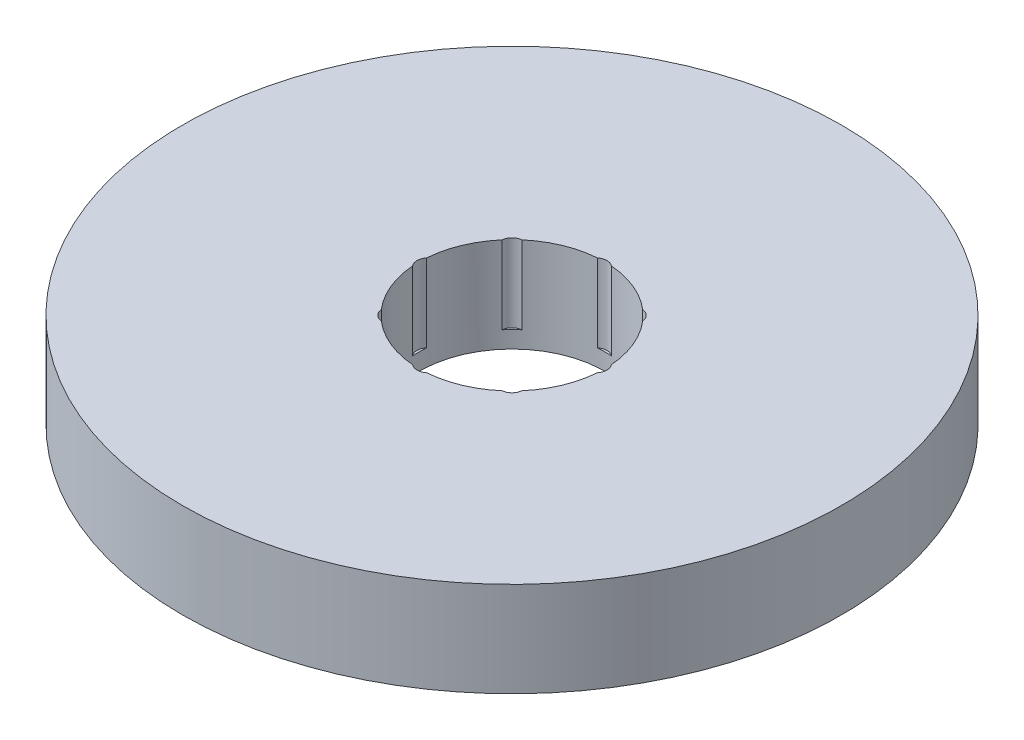
from build123d import *

# Parameters (mm, degrees)
SKETCH1_R           = 80
BOSS_EXTRUDE1_DEPTH = 23
SKETCH2_R           = 22.5
CUT_EXTRUDE1_DEPTH  = 116.451288429
SKETCH3_R           = 2.685496168
CUT_EXTRUDE2_DEPTH  = 18.910605263
CIRPATTERN1_COUNT   = 8


with BuildPart() as part:
    # Sketch1 → Boss-Extrude1 (new body)
    with BuildSketch(Plane(origin=(0, 0, 0), x_dir=(1, 0, 0), z_dir=(0, 1, 0))):
        Circle(SKETCH1_R)
    extrude(amount=BOSS_EXTRUDE1_DEPTH)

    # Sketch2 → Cut-Extrude1 (cut, through all)
    with BuildSketch(Plane(origin=(0, 0, 0), x_dir=(1, 0, 0), z_dir=(0, 1, 0))):
        Circle(SKETCH2_R)
    extrude(amount=CUT_EXTRUDE1_DEPTH, mode=Mode.SUBTRACT)

    # Sketch3 → Cut-Extrude2 (cut)
    with BuildSketch(Plane(origin=(0, 23, 0), x_dir=(1, 0, 0), z_dir=(0, 1, 0))):
        with Locations((-20.353594527, 0)):
            Circle(SKETCH3_R)
    cut_extrude2 = extrude(amount=-CUT_EXTRUDE2_DEPTH, mode=Mode.SUBTRACT)

    # CirPattern1: Cut-Extrude2 ×8 about axis
    cirpattern1_axis = Axis((0, 0, 0), (0, 1, 0))
    for i in range(1, CIRPATTERN1_COUNT):
        add(cut_extrude2.rotate(cirpattern1_axis, i * 360 / CIRPATTERN1_COUNT), mode=Mode.SUBTRACT)


solid = part.part
